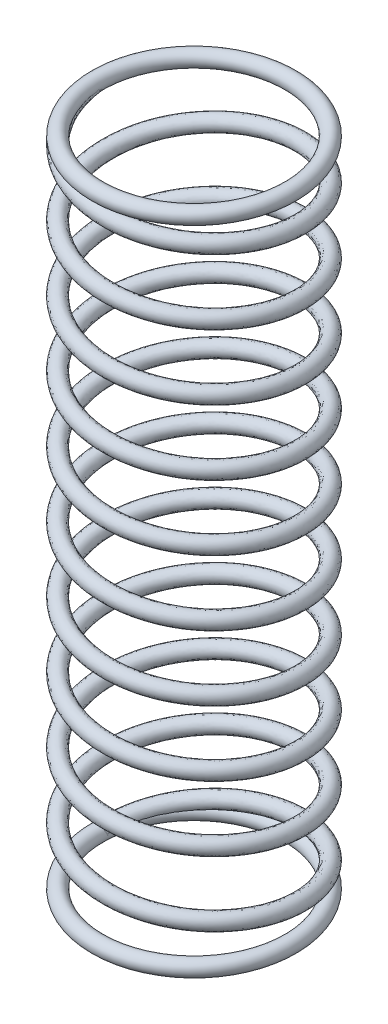
from build123d import *

# Parameters (mm, degrees)
BALAYAGE4_PROFILE_R   = 0.3
BALAYAGE5_PITCH       = 2.5
BALAYAGE5_HEIGHT      = 25
BALAYAGE5_RADIUS      = 3.7
BALAYAGE5_START_ANGLE = -90
BALAYAGE5_PROFILE_R   = 0.3
BALAYAGE8_PROFILE_R   = 0.3


with BuildPart() as part:
    # Balayage4: sweep along a path in Esquisse16
    with BuildLine(Plane(origin=(0, 0, 0), x_dir=(1, 0, 0), z_dir=(0, 1, 0))) as balayage4_path:
        CenterArc((0, 0), 3.7, 0, 360)
    # Balayage4 profile (on start of the path) → Balayage4 (sweep)
    with BuildSketch(Plane(origin=(3.7, 0, 0), x_dir=(-1, 0, 0), z_dir=(0, 0, -1))):
        Circle(BALAYAGE4_PROFILE_R)
    sweep(path=balayage4_path.line)


with BuildPart() as body_2:
    # Balayage5: sweep along a helix
    with BuildLine() as balayage5_path:
        add(Helix(BALAYAGE5_PITCH, BALAYAGE5_HEIGHT, BALAYAGE5_RADIUS, center=(0, 0, 0), direction=(0, 1, 0), lefthand=True, mode=Mode.PRIVATE).rotate(Axis((0, 0, 0), (0, 1, 0)), BALAYAGE5_START_ANGLE))
    # Balayage5 profile (on start of the path) → Balayage5 (sweep)
    with BuildSketch(Plane(origin=(-3.7, 0, 0), x_dir=(0, -0.9942675543765723, -0.10692067299652544), z_dir=(-1.1451044840016491e-14, 0.10692067299652544, -0.9942675543765723))):
        Circle(BALAYAGE5_PROFILE_R)
    sweep(path=balayage5_path.line, is_frenet=True)


with BuildPart() as body_3:
    # Balayage8: sweep along a path in Esquisse68
    with BuildLine(Plane(origin=(0, 25, 0), x_dir=(1, 0, 0), z_dir=(0, 1, 0))) as balayage8_path:
        CenterArc((0, 0), 3.7, 0, 360)
    # Balayage8 profile (on start of the path) → Balayage8 (sweep)
    with BuildSketch(Plane(origin=(3.7, 25, 0), x_dir=(-1, 0, 0), z_dir=(0, 0, -1))):
        Circle(BALAYAGE8_PROFILE_R)
    sweep(path=balayage8_path.line)


solid = Compound([part.part, body_2.part, body_3.part])
